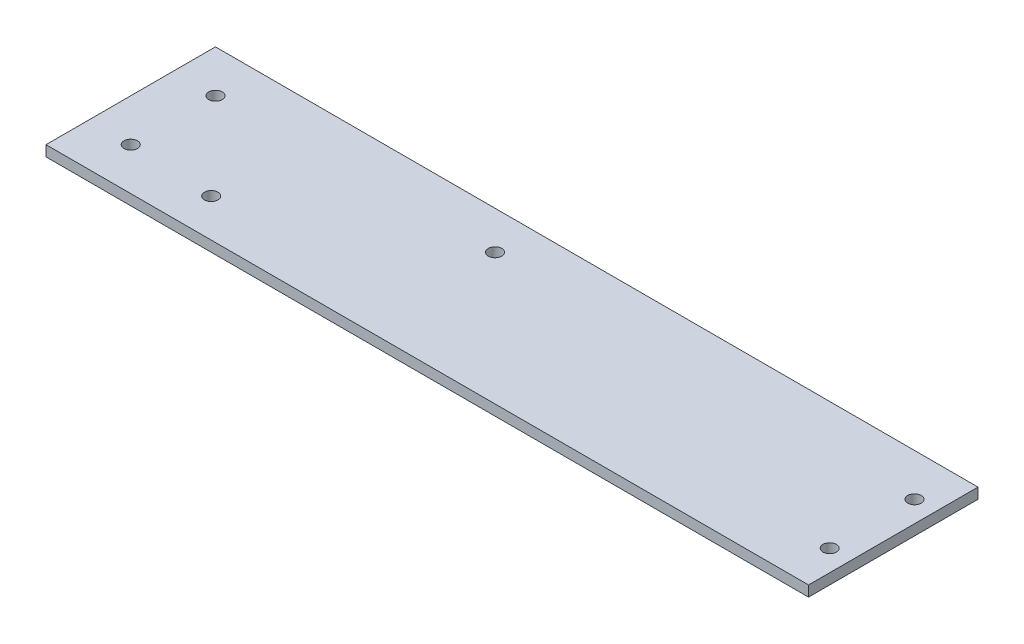
from build123d import *

# Parameters (mm, degrees)
SKETCH1_W              = 228.6
SKETCH1_H              = 50.8
BOSS_EXTRUDE1_DEPTH    = 3.175
F_10_32_TAPPED_HOLE2_D = 4.0386
F_10_32_TAPPED_HOLE1_D = 4.0386


with BuildPart() as part:
    # Sketch1 → Boss-Extrude1 (new body)
    with BuildSketch(Plane(origin=(0, 0, 0), x_dir=(1, 0, 0), z_dir=(0, 1, 0))):
        Rectangle(SKETCH1_W, SKETCH1_H)
    extrude(amount=BOSS_EXTRUDE1_DEPTH)

    # #10-32 Tapped Hole2 (through all)
    with Locations(Plane(origin=(0, 3.175, 0), x_dir=(1, 0, 0), z_dir=(0, 1, 0))):
        with Locations((107.95, 12.7), (-101.6, -12.7), (-101.6, 12.7), (107.95, -12.7)):
            Hole(F_10_32_TAPPED_HOLE2_D / 2)

    # #10-32 Tapped Hole1 (through all)
    with Locations(Plane(origin=(0, 3.175, 0), x_dir=(1, 0, 0), z_dir=(0, 1, 0))):
        with Locations((-76.2, -13.97), (-19.05, 13.97)):
            Hole(F_10_32_TAPPED_HOLE1_D / 2)


solid = part.part
